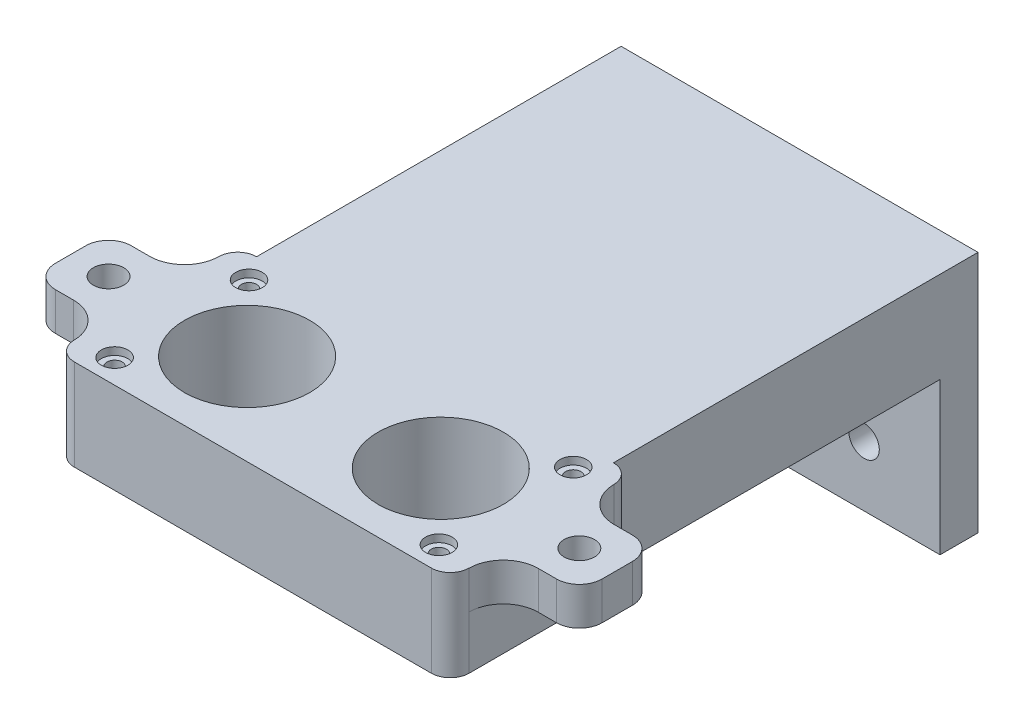
from build123d import *

# Parameters (mm, degrees)
SKETCH1_W           = 52
SKETCH1_H           = 24
SKETCH1_R           = 8.25
BOSS_EXTRUDE1_DEPTH = 12
SKETCH2_R           = 1
CUT_EXTRUDE1_DEPTH  = 32.048349393
SKETCH3_R           = 1.75
CUT_EXTRUDE2_DEPTH  = 1
FILLET1_R           = 2.5
CUT_EXTRUDE3_DEPTH  = 5
FILLET2_R           = 0.5
SKETCH6_W           = 10
SKETCH6_H           = 10
SKETCH6_R           = 2
BOSS_EXTRUDE2_DEPTH = 5
FILLET3_R           = 4.6
FILLET4_R           = 3
SKETCH9_W           = 47
SKETCH9_H           = 12
BOSS_EXTRUDE3_DEPTH = 48
SKETCH11_W          = 47
SKETCH11_H          = 5
BOSS_EXTRUDE5_DEPTH = 20
CUT_EXTRUDE5_REACH  = 84.946
SKETCH13_R          = 2
CUT_EXTRUDE6_REACH  = 84.946
SKETCH16_R          = 2


with BuildPart() as part:
    # Sketch1 → Boss-Extrude1 (new body)
    with BuildSketch(Plane(origin=(0, 0, 0), x_dir=(1, 0, 0), z_dir=(0, 1, 0))):
        Rectangle(SKETCH1_W, SKETCH1_H)
        with Locations(Location((12.75, 0, 0), (0, 0, 270))):
            Circle(SKETCH1_R, mode=Mode.SUBTRACT)
        with Locations(Location((-12.75, 0, 0), (0, 0, 270))):
            Circle(SKETCH1_R, mode=Mode.SUBTRACT)
    extrude(amount=BOSS_EXTRUDE1_DEPTH)

    # Sketch2 → Cut-Extrude1 (cut, through all)
    with BuildSketch(Plane(origin=(0, 12, 0), x_dir=(1, 0, 0), z_dir=(0, 1, 0))):
        with Locations(Location((-21.35, 8.85, 0), (0, 0, 270))):
            Circle(SKETCH2_R)
        with Locations(Location((21.35, 8.85, 0), (0, 0, 270))):
            Circle(SKETCH2_R)
        with Locations(Location((21.35, -8.85, 0), (0, 0, 270))):
            Circle(SKETCH2_R)
        with Locations(Location((-21.35, -8.85, 0), (0, 0, 270))):
            Circle(SKETCH2_R)
    extrude(amount=-CUT_EXTRUDE1_DEPTH, mode=Mode.SUBTRACT)

    # Sketch3 → Cut-Extrude2 (cut)
    with BuildSketch(Plane(origin=(0, 12, 0), x_dir=(1, 0, 0), z_dir=(0, 1, 0))):
        with Locations(Location((-21.35, 8.85, 0), (0, 0, 270))):
            Circle(SKETCH3_R)
        with Locations(Location((21.35, 8.85, 0), (0, 0, 270))):
            Circle(SKETCH3_R)
        with Locations(Location((21.35, -8.85, 0), (0, 0, 270))):
            Circle(SKETCH3_R)
        with Locations(Location((-21.35, -8.85, 0), (0, 0, 270))):
            Circle(SKETCH3_R)
    extrude(amount=-CUT_EXTRUDE2_DEPTH, mode=Mode.SUBTRACT)

    # Fillet1
    fillet1_edges = [part.edges().sort_by_distance(p)[0] for p in [
        (26, 6, 12),
        (-26, 6, 12),
        (-26, 6, -12),
        (26, 6, -12),
    ]]
    fillet(fillet1_edges, radius=FILLET1_R)

    # Sketch4 → Cut-Extrude3 (cut)
    with BuildSketch(Plane.XZ):
        Polygon((-6, -5), (-6, -12), (6, -12), (6, -5), (0, -5), align=None)
    extrude(amount=-CUT_EXTRUDE3_DEPTH, mode=Mode.SUBTRACT)

    # Fillet2
    fillet2_edges = [part.edges().sort_by_distance(p)[0] for p in [
        (0, 5, -12),
        (6, 2.5, -12),
        (-6, 2.5, -12),
        (-6, 2.5, -5),
        (6, 5, -8.5),
        (6, 2.5, -5),
        (-6, 5, -8.5),
        (0, 5, -5),
    ]]
    fillet(fillet2_edges, radius=FILLET2_R)

    # Sketch6 → Boss-Extrude2 (add)
    # profile 1 of 2: a face of its own
    with BuildSketch(Plane(origin=(0, 12, 0), x_dir=(1, 0, 0), z_dir=(0, 1, 0))):
        with Locations((-31, 0)):
            Rectangle(SKETCH6_W, SKETCH6_H)
        with Locations(Location((-31, 0, 0), (0, 0, 270))):
            Circle(SKETCH6_R, mode=Mode.SUBTRACT)
    # profile 2 of 2: a face of its own
    with BuildSketch(Plane(origin=(0, 12, 0), x_dir=(1, 0, 0), z_dir=(0, 1, 0))):
        with Locations((31, 0)):
            Rectangle(SKETCH6_W, SKETCH6_H)
        with Locations(Location((31, 0, 0), (0, 0, 90))):
            Circle(SKETCH6_R, mode=Mode.SUBTRACT)
    extrude(amount=-BOSS_EXTRUDE2_DEPTH)

    # Fillet3
    # the kernel refuses this fillet: 4.6 mm, written as the material it adds along each edge
    with BuildSketch(Plane(origin=(26, 12, 5), x_dir=(-5.467859312132584e-05, 0, 0.9999999985051258), z_dir=(0, -1, 0)), Plane(origin=(-26, 12, -5), x_dir=(5.467859312132586e-05, 0, -0.9999999985051258), z_dir=(0, -1, 0))) as fillet3_piece_1:
        with BuildLine():
            CenterArc((4.59974851, -4.599547254), FILLET3_R, 90.80387664, 89.192990507)
            Line((-0.000251483, -4.599295733), (-0.460251482, -4.599270581))
            Line((-0.460251482, -4.599270581), (-0.459999999, 2.5152e-05))
            Line((-0.459999999, 2.5152e-05), (2.5152e-05, 0.459999999))
            ThreePointArc((2.5152e-05, 0.459999999), (4.500025145, 0.459753946), (4.528757551, 0.459954725))
            Line((4.528757551, 0.459954725), (4.535211274, 0))
        make_face()
    extrude(amount=5)
    with BuildSketch(Plane(origin=(-26, 12, 5), x_dir=(5.467859312289258e-05, 0, 0.9999999985051258), z_dir=(0, -1, 0)), Plane(origin=(26, 12, -5), x_dir=(-5.467859312132581e-05, 0, -0.9999999985051258), z_dir=(0, -1, 0))) as fillet3_piece_2:
        with BuildLine():
            CenterArc((4.59974851, 4.599547254), FILLET3_R, 180.003132853, 89.192990507)
            Line((-0.000251483, 4.599295733), (-0.460251482, 4.599270581))
            Line((-0.460251482, 4.599270581), (-0.459999999, -2.5152e-05))
            Line((-0.459999999, -2.5152e-05), (2.5152e-05, -0.459999999))
            ThreePointArc((2.5152e-05, -0.459999999), (4.500025145, -0.459753946), (4.528757551, -0.459954725))
            Line((4.528757551, -0.459954725), (4.535211274, 0))
        make_face()
    extrude(amount=5)

    # Fillet4
    fillet4_edges = [part.edges().sort_by_distance(p)[0] for p in [
        (-36, 9.5, 5),
        (-36, 9.5, -5),
        (36, 9.5, -5),
        (36, 9.5, 5),
    ]]
    fillet(fillet4_edges, radius=FILLET4_R)

    # Sketch9 → Boss-Extrude3 (add)
    with BuildSketch(Plane(origin=(0, 0, -12), x_dir=(-1, 0, 0), z_dir=(0, 0, -1))):
        with Locations((0, 6)):
            Rectangle(SKETCH9_W, SKETCH9_H)
    extrude(amount=BOSS_EXTRUDE3_DEPTH)

    # Sketch11 → Boss-Extrude5 (add)
    with BuildSketch(Plane.XZ):
        with Locations((0, -57.5)):
            Rectangle(SKETCH11_W, SKETCH11_H)
    extrude(amount=BOSS_EXTRUDE5_DEPTH)

    # Sketch13 → Cut-Extrude5 (cut, up to next)
    with BuildSketch(Plane(origin=(0, 0, -60), x_dir=(-1, 0, 0), z_dir=(0, 0, -1)), mode=Mode.PRIVATE) as cut_extrude5_sk1:
        with Locations((0, -12)):
            Circle(SKETCH13_R)
    cut_extrude5_tool1 = extrude(cut_extrude5_sk1.sketch, amount=-CUT_EXTRUDE5_REACH, mode=Mode.PRIVATE) & part.part
    # Sketch13 → Cut-Extrude5 (cut, up to next)
    with BuildSketch(Plane(origin=(0, 0, -60), x_dir=(-1, 0, 0), z_dir=(0, 0, -1)), mode=Mode.PRIVATE) as cut_extrude5_sk2:
        with Locations((-13.5, -12)):
            Circle(SKETCH13_R)
    cut_extrude5_tool2 = extrude(cut_extrude5_sk2.sketch, amount=-CUT_EXTRUDE5_REACH, mode=Mode.PRIVATE) & part.part
    # Sketch13 → Cut-Extrude5 (cut, up to next)
    with BuildSketch(Plane(origin=(0, 0, -60), x_dir=(-1, 0, 0), z_dir=(0, 0, -1)), mode=Mode.PRIVATE) as cut_extrude5_sk3:
        with Locations((13.5, -12)):
            Circle(SKETCH13_R)
    cut_extrude5_tool3 = extrude(cut_extrude5_sk3.sketch, amount=-CUT_EXTRUDE5_REACH, mode=Mode.PRIVATE) & part.part
    add(cut_extrude5_tool1.solids().sort_by_distance((0, -12, -60))[0], mode=Mode.SUBTRACT)
    add(cut_extrude5_tool2.solids().sort_by_distance((13.5, -12, -60))[0], mode=Mode.SUBTRACT)
    add(cut_extrude5_tool3.solids().sort_by_distance((-13.5, -12, -60))[0], mode=Mode.SUBTRACT)

    # Sketch16 → Cut-Extrude6 (cut, up to next)
    with BuildSketch(Plane(origin=(0, 0, -60), x_dir=(-1, 0, 0), z_dir=(0, 0, -1)), mode=Mode.PRIVATE) as cut_extrude6_sk1:
        with Locations((0, -4)):
            Circle(SKETCH16_R)
    cut_extrude6_tool1 = extrude(cut_extrude6_sk1.sketch, amount=-CUT_EXTRUDE6_REACH, mode=Mode.PRIVATE) & part.part
    add(cut_extrude6_tool1.solids().sort_by_distance((0, -4, -60))[0], mode=Mode.SUBTRACT)


solid = part.part
